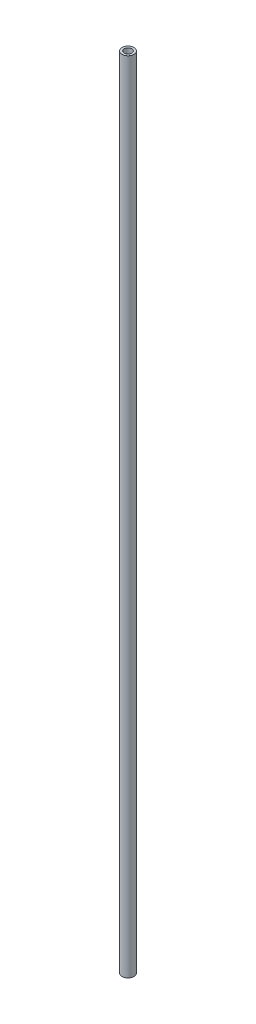
from build123d import *

# Parameters (mm, degrees)
SKETCH1_R           = 1
BOSS_EXTRUDE1_DEPTH = 133.2


with BuildPart() as part:
    # Sketch1 → Boss-Extrude1 (new body)
    with BuildSketch(Plane(origin=(0, 0, 0), x_dir=(1, 0, 0), z_dir=(0, 1, 0))):
        Circle(SKETCH1_R)
    extrude(amount=BOSS_EXTRUDE1_DEPTH)

    # Sketch4 → M1.6x0.35 Tapped Hole1 (revolve, cut)
    with BuildSketch(Plane(origin=(0, 133.2, 0), x_dir=(0, 0, 1), z_dir=(1, 0, 0))):
        Polygon((0, 0), (0, 6.375537887), (0.625, 6), (0.625, 0), align=None)
    m1_6x0_35_tapped_hole1 = revolve(axis=Axis((0, 139.55, 0), (0, -1, 0)), mode=Mode.SUBTRACT)

    # Mirror1: M1.6x0.35 Tapped Hole1 across plane
    add(m1_6x0_35_tapped_hole1.mirror(Plane(origin=(0, 66.6, 0), x_dir=(0, 0, 1), z_dir=(0, -1, 0))), mode=Mode.SUBTRACT)


solid = part.part
